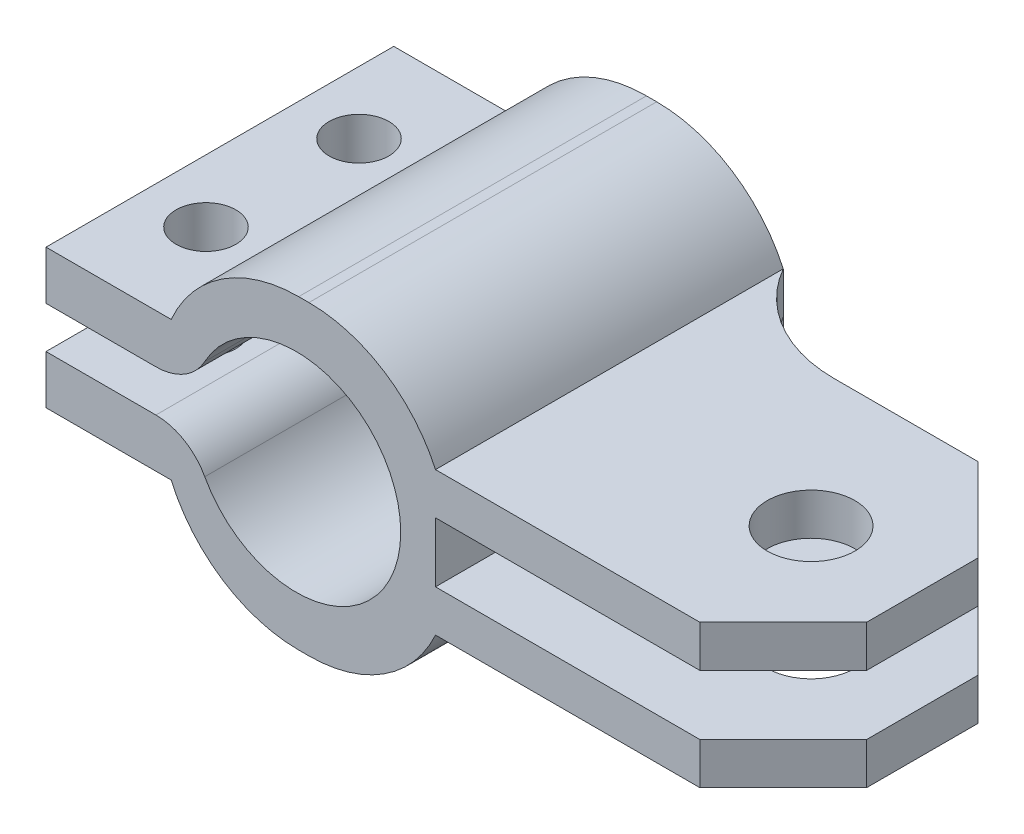
from build123d import *

# Parameters (mm, degrees)
SKETCH_1_W          = 25
SKETCH_1_H          = 22
SKETCH_1_R          = 7.5
EXTRUDE_1_DEPTH     = 25
SKETCH_2_W          = 20
SKETCH_2_H          = 3
EXTRUDE_2_DEPTH     = 25
SKETCH_3_R          = 3.15
CUT_EXTRUDE_1_DEPTH = 25
FILLET_2_R          = 10
SKETCH_4_W          = 6
SKETCH_4_H          = 6
CUT_EXTRUDE_2_DEPTH = 25
FILLET_3_R          = 10
FILLET_4_R          = 10
SKETCH_5_W          = 21.715962642
SKETCH_5_H          = 3
CUT_EXTRUDE_3_DEPTH = 25
FILLET_5_R          = 4
SKETCH_8_W          = 25
SKETCH_8_H          = 3.5
EXTRUDE_3_DEPTH     = 3
SKETCH_6_R          = 2.15
CUT_EXTRUDE_4_DEPTH = 25
CHAMFER_1_SIZE      = 6


with BuildPart() as part:
    # 草图1 → 凸台-拉伸1 (new body)
    with BuildSketch(Plane.XY):
        Rectangle(SKETCH_1_W, SKETCH_1_H)
        with Locations((2.5, 0)):
            Circle(SKETCH_1_R, mode=Mode.SUBTRACT)
    extrude(amount=EXTRUDE_1_DEPTH)

    # 草图2 → 凸台-拉伸2 (add)
    with BuildSketch(Plane(origin=(12.5, 0, 0), x_dir=(0, 0, -1), z_dir=(1, 0, 0))):
        with Locations((-15, 3.65)):
            Rectangle(SKETCH_2_W, SKETCH_2_H)
        with Locations((-15, -3.65)):
            Rectangle(SKETCH_2_W, SKETCH_2_H)
    extrude(amount=EXTRUDE_2_DEPTH)

    # 草图3 → 切除-拉伸1 (cut)
    with BuildSketch(Plane(origin=(0, 5.15, 0), x_dir=(1, 0, 0), z_dir=(0, 1, 0))):
        with Locations(Location((29.5, -15, 0), (0, 0, 270))):
            Circle(SKETCH_3_R)
    extrude(amount=-CUT_EXTRUDE_1_DEPTH, mode=Mode.SUBTRACT)

    # 圆角2
    # the kernel refuses this fillet: 10 mm, written as the material it adds along each edge
    with BuildSketch(Plane(origin=(12.5, 5.15, 5), x_dir=(0, 0, -1), z_dir=(0, -1, 0)), Plane(origin=(12.5, -2.15, 5), x_dir=(0, 0, -1), z_dir=(0, -1, 0))) as fillet_2_piece_1:
        with BuildLine():
            CenterArc((10, 8.660254038), FILLET_2_R, 180, 60)
            Line((0, 8.660254038), (-0.2, 8.660254038))
            Line((-0.2, 8.660254038), (-0.2, 0))
            Line((-0.2, 0), (0, -0.2))
            ThreePointArc((0, -0.2), (2.5, -0.2), (4.9, -0.173205081))
            Line((4.9, -0.173205081), (5, 0))
        make_face()
    extrude(amount=3)
    with BuildSketch(Plane(origin=(12.5, 5.15, 5), x_dir=(0, 0, -1), z_dir=(0, -1, 0))) as fillet_2_piece_2_section:
        with BuildLine():
            CenterArc((10, 8.660254038), FILLET_2_R, 180, 60)
            Line((0, 8.660254038), (-0.2, 8.660254038))
            Line((-0.2, 8.660254038), (-0.2, 0))
            Line((-0.2, 0), (0, -0.2))
            ThreePointArc((0, -0.2), (2.5, -0.2), (4.9, -0.173205081))
            Line((4.9, -0.173205081), (5, 0))
        make_face()
    fillet_2_piece_2 = extrude(amount=24.650635095, mode=Mode.PRIVATE)
    fillet_2_piece_2 = split(fillet_2_piece_2, bisect_by=Plane(origin=(14.663104458, -5.15, 3.704832889), z_dir=(0, 1, 0)), keep=Keep.TOP, mode=Mode.PRIVATE)
    fillet_2_piece_2 = split(fillet_2_piece_2, bisect_by=Plane(origin=(14.663104458, -2.15, 3.704832889), z_dir=(0, -1, 0)), keep=Keep.TOP, mode=Mode.PRIVATE)
    add(fillet_2_piece_2)
    with BuildSketch(Plane(origin=(12.5, 19.500635095, 5), x_dir=(0, 0, -1), z_dir=(0, -1, 0))) as fillet_2_piece_3_section:
        with BuildLine():
            CenterArc((10, 8.660254038), FILLET_2_R, 180, 60)
            Line((0, 8.660254038), (-0.2, 8.660254038))
            Line((-0.2, 8.660254038), (-0.2, 0))
            Line((-0.2, 0), (0, -0.2))
            ThreePointArc((0, -0.2), (2.5, -0.2), (4.9, -0.173205081))
            Line((4.9, -0.173205081), (5, 0))
        make_face()
    fillet_2_piece_3 = extrude(amount=24.650635095, mode=Mode.PRIVATE)
    fillet_2_piece_3 = split(fillet_2_piece_3, bisect_by=Plane(origin=(14.663104458, 2.15, 3.704832889), z_dir=(0, 1, 0)), keep=Keep.TOP, mode=Mode.PRIVATE)
    fillet_2_piece_3 = split(fillet_2_piece_3, bisect_by=Plane(origin=(14.663104458, 5.15, 3.704832889), z_dir=(0, -1, 0)), keep=Keep.TOP, mode=Mode.PRIVATE)
    add(fillet_2_piece_3)

    # 草图4 → 切除-拉伸2 (cut)
    with BuildSketch(Plane(origin=(0, 0, 0), x_dir=(-1, 0, 0), z_dir=(0, 0, -1))):
        with Locations((9.5, 8)):
            Rectangle(SKETCH_4_W, SKETCH_4_H)
        with Locations((9.5, -8)):
            Rectangle(SKETCH_4_W, SKETCH_4_H)
    extrude(amount=-CUT_EXTRUDE_2_DEPTH, mode=Mode.SUBTRACT)

    # 圆角3
    # the kernel refuses this fillet: 10 mm, written as the material it takes off along each edge
    with BuildSketch(Plane(origin=(-6.5, -11, -22.912878475), x_dir=(0, 1, 0), z_dir=(0, 0, 1))) as fillet_3_piece_1:
        with BuildLine():
            CenterArc((10, -9.16515139), FILLET_3_R, 113.578178478, 66.421821522)
            Line((0, -9.16515139), (-0.2, -9.16515139))
            Line((-0.2, -9.16515139), (-0.2, 0))
            Line((-0.2, 0), (0, 0.2))
            ThreePointArc((0, 0.2), (3, 0.2), (5.92, 0.183303028))
            Line((5.92, 0.183303028), (6, 0))
        make_face()
    extrude(amount=70.82575695, mode=Mode.SUBTRACT)
    with BuildSketch(Plane(origin=(-6.5, 11, -22.912878475), x_dir=(1, 0, 0), z_dir=(0, 0, 1))) as fillet_3_piece_2:
        with BuildLine():
            CenterArc((9.16515139, -10), FILLET_3_R, 90, 66.421821522)
            Line((0, -6), (-0.183303028, -5.92))
            ThreePointArc((-0.183303028, -5.92), (-0.2, -3), (-0.2, 0))
            Line((-0.2, 0), (0, 0.2))
            Line((0, 0.2), (9.16515139, 0.2))
            Line((9.16515139, 0.2), (9.16515139, 0))
        make_face()
    extrude(amount=70.82575695, mode=Mode.SUBTRACT)

    # 圆角4
    # the kernel refuses this fillet: 10 mm, written as the material it takes off along each edge
    with BuildSketch(Plane(origin=(12.5, 11, -22.745535276), x_dir=(0, -1, 0), z_dir=(0, 0, 1))) as fillet_4_piece_1:
        with BuildLine():
            CenterArc((10, -9.09821411), FILLET_4_R, 114.519316483, 65.480683517)
            Line((0, -9.09821411), (-0.2, -9.09821411))
            Line((-0.2, -9.09821411), (-0.2, 0))
            Line((-0.2, 0), (0, 0.2))
            ThreePointArc((0, 0.2), (2.925, 0.2), (5.767, 0.181964282))
            Line((5.767, 0.181964282), (5.85, 0))
        make_face()
    extrude(amount=70.491070552, mode=Mode.SUBTRACT)
    with BuildSketch(Plane(origin=(12.5, -11, -22.745535276), x_dir=(-1, 0, 0), z_dir=(0, 0, 1))) as fillet_4_piece_2:
        with BuildLine():
            CenterArc((9.09821411, -10), FILLET_4_R, 90, 65.480683517)
            Line((0, -5.85), (-0.181964282, -5.767))
            ThreePointArc((-0.181964282, -5.767), (-0.2, -2.925), (-0.2, 0))
            Line((-0.2, 0), (0, 0.2))
            Line((0, 0.2), (9.09821411, 0.2))
            Line((9.09821411, 0.2), (9.09821411, 0))
        make_face()
    extrude(amount=70.491070552, mode=Mode.SUBTRACT)

    # 草图5 → 切除-拉伸3 (cut)
    with BuildSketch(Plane(origin=(0, 0, 0), x_dir=(-1, 0, 0), z_dir=(0, 0, -1))):
        with Locations((12.5, 0)):
            Rectangle(SKETCH_5_W, SKETCH_5_H)
    extrude(amount=-CUT_EXTRUDE_3_DEPTH, mode=Mode.SUBTRACT)

    # 圆角5
    fillet_5_edges = [part.edges().sort_by_distance(p)[0] for p in [
        (-4.848469228, -1.5, 12.5),
        (-4.848469228, 1.5, 12.5),
    ]]
    fillet(fillet_5_edges, radius=FILLET_5_R)

    # 草图8 → 凸台-拉伸3 (add)
    with BuildSketch(Plane.ZY.offset(12.5)):
        with Locations((12.5, 3.25)):
            Rectangle(SKETCH_8_W, SKETCH_8_H)
        with Locations((12.5, -3.25)):
            Rectangle(SKETCH_8_W, SKETCH_8_H)
    extrude(amount=EXTRUDE_3_DEPTH)

    # 草图6 → 切除-拉伸4 (cut)
    with BuildSketch(Plane(origin=(0, 5, 0), x_dir=(1, 0, 0), z_dir=(0, 1, 0))):
        with Locations(Location((-11, -7, 0), (0, 0, 180))):
            Circle(SKETCH_6_R)
        with Locations(Location((-11, -18, 0), (0, 0, 180))):
            Circle(SKETCH_6_R)
    extrude(amount=-CUT_EXTRUDE_4_DEPTH, mode=Mode.SUBTRACT)

    # 倒角1
    chamfer_1_edges = [part.edges().sort_by_distance(p)[0] for p in [
        (37.5, 3.65, 25),
        (37.5, 3.65, 5),
        (37.5, -3.65, 25),
        (37.5, -3.65, 5),
    ]]
    chamfer(chamfer_1_edges, length=CHAMFER_1_SIZE)


solid = part.part
